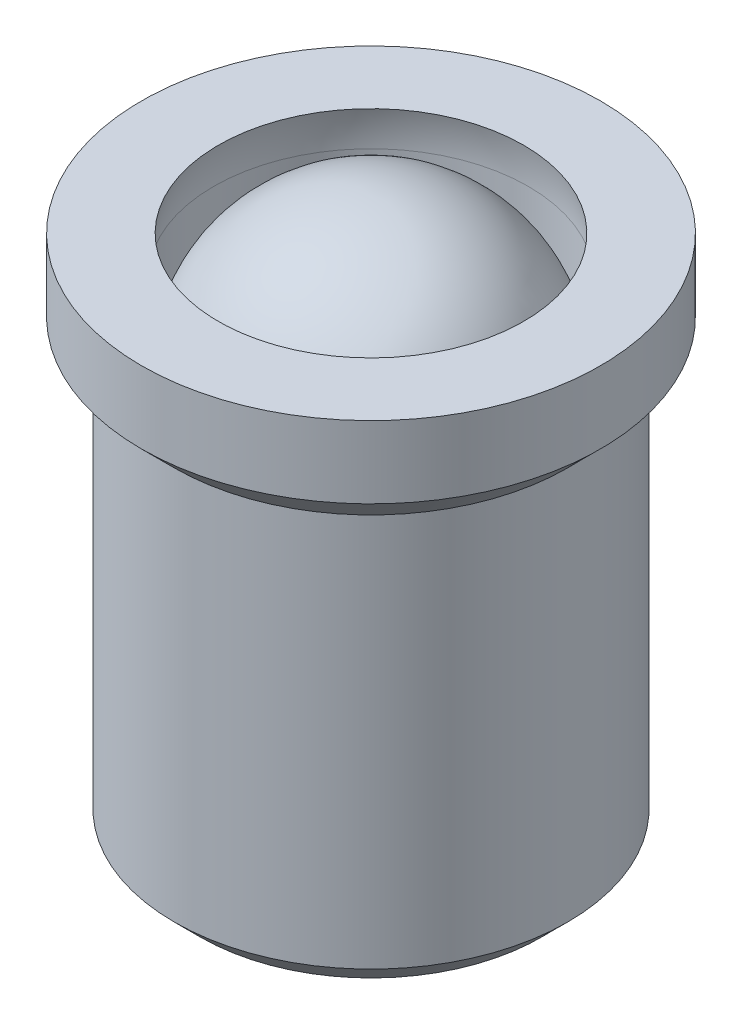
from build123d import *

# Parameters (mm, degrees)
CHAMFER_1_SIZE = 0.2
CHAMFER_2_SIZE = 0.25


with BuildPart() as part:
    # 草图1 → 旋转1 (revolve)
    with BuildSketch(Plane(origin=(0, 0, 0), x_dir=(0, 0, -1), z_dir=(1, 0, 0))):
        with BuildLine():
            Line((0.3, 0), (1.5, 0))
            Line((1.5, 0), (1.5, 3.2))
            Line((1.5, 3.2), (1.75, 3.2))
            Line((1.75, 3.2), (1.75, 4))
            Line((1.75, 4), (1.164431192, 4))
            ThreePointArc((1.164431192, 4), (1.191074605, 3.856086567), (1.2, 3.71))
            Line((1.2, 3.71), (1.2, 0.3))
            Line((1.2, 0.3), (0.3, 0.3))
            Line((0.3, 0.3), (0.3, 0))
        make_face()
    revolve(axis=Axis((0, 0, 0), (0, 1, 0)))

    # 倒角1
    chamfer_1_edges = [part.edges().sort_by_distance(p)[0] for p in [
        (0, 0, 1.5),
    ]]
    chamfer(chamfer_1_edges, length=CHAMFER_1_SIZE)

    # 倒角2
    chamfer_2_edges = [part.edges().sort_by_distance(p)[0] for p in [
        (0, 3.2, 1.75),
    ]]
    chamfer(chamfer_2_edges, length=CHAMFER_2_SIZE - 0.0001)  # a hair under: the kernel refuses the full size


with BuildPart() as body_2:
    # 草图2 → 旋转2 (revolve)
    with BuildSketch(Plane(origin=(0, 0, 0), x_dir=(0, 0, -1), z_dir=(1, 0, 0))):
        with BuildLine():
            Line((0, 4.25), (0, 1.87))
            ThreePointArc((0, 1.87), (1.19, 3.06), (0, 4.25))
        make_face()
    revolve(axis=Axis((0, 5.532857048, 0), (0, -1, 0)))


solid = Compound([part.part, body_2.part])
